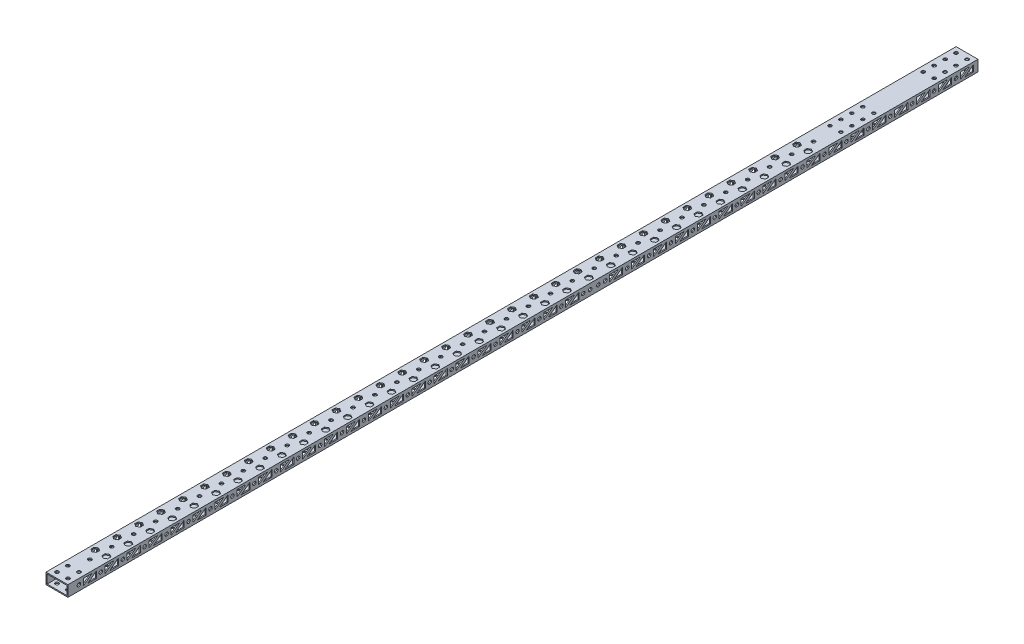
from build123d import *

# Parameters (mm, degrees)
SKETCH_1_W          = 20
SKETCH_1_H          = 10
SKETCH_1_W_2        = 18
SKETCH_1_H_2        = 8
EXTRUDE_1_DEPTH     = 830
SKETCH_2_R          = 1.575
SKETCH_2_R_2        = 1.5
CUT_EXTRUDE_1_DEPTH = 831.301150186
SKETCH_4_R          = 1.575
SKETCH_4_R_2        = 1.6
CUT_EXTRUDE_2_DEPTH = 831.301150186


with BuildPart() as part:
    # 草图1 → 拉伸-薄壁1 (new body)
    with BuildSketch(Plane.XY):
        with Locations((10, -5)):
            Rectangle(SKETCH_1_W, SKETCH_1_H)
        with Locations((10, -5)):
            Rectangle(SKETCH_1_W_2, SKETCH_1_H_2, mode=Mode.SUBTRACT)
    extrude(amount=EXTRUDE_1_DEPTH)

    # 草图2 → 切除-拉伸1 (cut, through all)
    with BuildSketch(Plane.XZ.offset(10)):
        with Locations((5, 5)):
            Circle(SKETCH_2_R)
        with Locations((15, 5)):
            Circle(SKETCH_2_R)
        with Locations((15, 15)):
            Circle(SKETCH_2_R)
        with Locations((5, 15)):
            Circle(SKETCH_2_R)
        with Locations((10, 140)):
            Circle(SKETCH_2_R)
        with Locations((10, 160)):
            Circle(SKETCH_2_R)
        with Locations((10, 180)):
            Circle(SKETCH_2_R)
        with Locations((10, 200)):
            Circle(SKETCH_2_R)
        with Locations((10, 220)):
            Circle(SKETCH_2_R)
        with Locations((10, 240)):
            Circle(SKETCH_2_R)
        with Locations((10, 260)):
            Circle(SKETCH_2_R)
        with Locations((10, 280)):
            Circle(SKETCH_2_R)
        with Locations((10, 300)):
            Circle(SKETCH_2_R)
        with Locations((10, 320)):
            Circle(SKETCH_2_R)
        with Locations((10, 340)):
            Circle(SKETCH_2_R)
        with Locations((10, 360)):
            Circle(SKETCH_2_R)
        with Locations((10, 380)):
            Circle(SKETCH_2_R)
        with Locations((10, 400)):
            Circle(SKETCH_2_R)
        with Locations((10, 420)):
            Circle(SKETCH_2_R)
        with Locations((10, 440)):
            Circle(SKETCH_2_R)
        with Locations((10, 460)):
            Circle(SKETCH_2_R)
        with Locations((10, 480)):
            Circle(SKETCH_2_R)
        with Locations((10, 500)):
            Circle(SKETCH_2_R)
        with Locations((10, 520)):
            Circle(SKETCH_2_R)
        with Locations((10, 540)):
            Circle(SKETCH_2_R)
        with Locations((10, 560)):
            Circle(SKETCH_2_R)
        with Locations((10, 580)):
            Circle(SKETCH_2_R)
        with Locations((10, 600)):
            Circle(SKETCH_2_R)
        with Locations((10, 620)):
            Circle(SKETCH_2_R)
        with Locations((10, 640)):
            Circle(SKETCH_2_R)
        with Locations((10, 660)):
            Circle(SKETCH_2_R)
        with Locations((10, 680)):
            Circle(SKETCH_2_R)
        with Locations((10, 700)):
            Circle(SKETCH_2_R)
        with Locations((10, 720)):
            Circle(SKETCH_2_R)
        with Locations((10, 740)):
            Circle(SKETCH_2_R)
        with Locations((5, 815)):
            Circle(SKETCH_2_R)
        with Locations((15, 815)):
            Circle(SKETCH_2_R)
        with Locations((15, 825)):
            Circle(SKETCH_2_R)
        with Locations((5, 825)):
            Circle(SKETCH_2_R)
        with Locations((10, 760)):
            Circle(SKETCH_2_R)
        with Locations((10, 780)):
            Circle(SKETCH_2_R)
        with Locations((10, 800)):
            Circle(SKETCH_2_R)
        with Locations((5, 120)):
            Circle(SKETCH_2_R_2)
        with Locations((15, 120)):
            Circle(SKETCH_2_R_2)
        with Locations((15, 110)):
            Circle(SKETCH_2_R_2)
        with Locations((5, 110)):
            Circle(SKETCH_2_R_2)
        with Locations((5, 100)):
            Circle(SKETCH_2_R_2)
        with Locations((15, 100)):
            Circle(SKETCH_2_R_2)
        with Locations((15, 90)):
            Circle(SKETCH_2_R_2)
        with Locations((5, 90)):
            Circle(SKETCH_2_R_2)
        with Locations((5, 25)):
            Circle(SKETCH_2_R)
        with Locations((15, 25)):
            Circle(SKETCH_2_R)
        with Locations((15, 35)):
            Circle(SKETCH_2_R)
        with Locations((5, 35)):
            Circle(SKETCH_2_R)
        Polygon((15.098076211, 787), (17.696152423, 788.5), (17.696152423, 791.5), (15.098076211, 793), (12.5, 791.5), (12.5, 788.5), align=None)
        Polygon((7.5, 788.5), (4.901923789, 787), (2.303847577, 788.5), (2.303847577, 791.5), (4.901923789, 793), (7.5, 791.5), align=None)
        Polygon((2.303847577, 771.5), (4.901923789, 773), (7.5, 771.5), (7.5, 768.5), (4.901923789, 767), (2.303847577, 768.5), align=None)
        Polygon((15.098076211, 773), (12.5, 771.5), (12.5, 768.5), (15.098076211, 767), (17.696152423, 768.5), (17.696152423, 771.5), align=None)
        Polygon((2.303847577, 751.5), (4.901923789, 753), (7.5, 751.5), (7.5, 748.5), (4.901923789, 747), (2.303847577, 748.5), align=None)
        Polygon((15.098076211, 753), (12.5, 751.5), (12.5, 748.5), (15.098076211, 747), (17.696152423, 748.5), (17.696152423, 751.5), align=None)
        Polygon((2.303847577, 731.5), (4.901923789, 733), (7.5, 731.5), (7.5, 728.5), (4.901923789, 727), (2.303847577, 728.5), align=None)
        Polygon((15.098076211, 733), (12.5, 731.5), (12.5, 728.5), (15.098076211, 727), (17.696152423, 728.5), (17.696152423, 731.5), align=None)
        Polygon((2.303847577, 711.5), (4.901923789, 713), (7.5, 711.5), (7.5, 708.5), (4.901923789, 707), (2.303847577, 708.5), align=None)
        Polygon((15.098076211, 713), (12.5, 711.5), (12.5, 708.5), (15.098076211, 707), (17.696152423, 708.5), (17.696152423, 711.5), align=None)
        Polygon((2.303847577, 691.5), (4.901923789, 693), (7.5, 691.5), (7.5, 688.5), (4.901923789, 687), (2.303847577, 688.5), align=None)
        Polygon((15.098076211, 693), (12.5, 691.5), (12.5, 688.5), (15.098076211, 687), (17.696152423, 688.5), (17.696152423, 691.5), align=None)
        Polygon((2.303847577, 671.5), (4.901923789, 673), (7.5, 671.5), (7.5, 668.5), (4.901923789, 667), (2.303847577, 668.5), align=None)
        Polygon((15.098076211, 673), (12.5, 671.5), (12.5, 668.5), (15.098076211, 667), (17.696152423, 668.5), (17.696152423, 671.5), align=None)
        Polygon((2.303847577, 651.5), (4.901923789, 653), (7.5, 651.5), (7.5, 648.5), (4.901923789, 647), (2.303847577, 648.5), align=None)
        Polygon((15.098076211, 653), (12.5, 651.5), (12.5, 648.5), (15.098076211, 647), (17.696152423, 648.5), (17.696152423, 651.5), align=None)
        Polygon((2.303847577, 631.5), (4.901923789, 633), (7.5, 631.5), (7.5, 628.5), (4.901923789, 627), (2.303847577, 628.5), align=None)
        Polygon((15.098076211, 633), (12.5, 631.5), (12.5, 628.5), (15.098076211, 627), (17.696152423, 628.5), (17.696152423, 631.5), align=None)
        Polygon((2.303847577, 611.5), (4.901923789, 613), (7.5, 611.5), (7.5, 608.5), (4.901923789, 607), (2.303847577, 608.5), align=None)
        Polygon((15.098076211, 613), (12.5, 611.5), (12.5, 608.5), (15.098076211, 607), (17.696152423, 608.5), (17.696152423, 611.5), align=None)
        Polygon((2.303847577, 591.5), (4.901923789, 593), (7.5, 591.5), (7.5, 588.5), (4.901923789, 587), (2.303847577, 588.5), align=None)
        Polygon((15.098076211, 593), (12.5, 591.5), (12.5, 588.5), (15.098076211, 587), (17.696152423, 588.5), (17.696152423, 591.5), align=None)
        Polygon((2.303847577, 571.5), (4.901923789, 573), (7.5, 571.5), (7.5, 568.5), (4.901923789, 567), (2.303847577, 568.5), align=None)
        Polygon((15.098076211, 573), (12.5, 571.5), (12.5, 568.5), (15.098076211, 567), (17.696152423, 568.5), (17.696152423, 571.5), align=None)
        Polygon((2.303847577, 551.5), (4.901923789, 553), (7.5, 551.5), (7.5, 548.5), (4.901923789, 547), (2.303847577, 548.5), align=None)
        Polygon((15.098076211, 553), (12.5, 551.5), (12.5, 548.5), (15.098076211, 547), (17.696152423, 548.5), (17.696152423, 551.5), align=None)
        Polygon((2.303847577, 531.5), (4.901923789, 533), (7.5, 531.5), (7.5, 528.5), (4.901923789, 527), (2.303847577, 528.5), align=None)
        Polygon((15.098076211, 533), (12.5, 531.5), (12.5, 528.5), (15.098076211, 527), (17.696152423, 528.5), (17.696152423, 531.5), align=None)
        Polygon((2.303847577, 511.5), (4.901923789, 513), (7.5, 511.5), (7.5, 508.5), (4.901923789, 507), (2.303847577, 508.5), align=None)
        Polygon((15.098076211, 513), (12.5, 511.5), (12.5, 508.5), (15.098076211, 507), (17.696152423, 508.5), (17.696152423, 511.5), align=None)
        Polygon((2.303847577, 491.5), (4.901923789, 493), (7.5, 491.5), (7.5, 488.5), (4.901923789, 487), (2.303847577, 488.5), align=None)
        Polygon((15.098076211, 493), (12.5, 491.5), (12.5, 488.5), (15.098076211, 487), (17.696152423, 488.5), (17.696152423, 491.5), align=None)
        Polygon((2.303847577, 471.5), (4.901923789, 473), (7.5, 471.5), (7.5, 468.5), (4.901923789, 467), (2.303847577, 468.5), align=None)
        Polygon((15.098076211, 473), (12.5, 471.5), (12.5, 468.5), (15.098076211, 467), (17.696152423, 468.5), (17.696152423, 471.5), align=None)
        Polygon((2.303847577, 451.5), (4.901923789, 453), (7.5, 451.5), (7.5, 448.5), (4.901923789, 447), (2.303847577, 448.5), align=None)
        Polygon((15.098076211, 453), (12.5, 451.5), (12.5, 448.5), (15.098076211, 447), (17.696152423, 448.5), (17.696152423, 451.5), align=None)
        Polygon((2.303847577, 431.5), (4.901923789, 433), (7.5, 431.5), (7.5, 428.5), (4.901923789, 427), (2.303847577, 428.5), align=None)
        Polygon((15.098076211, 433), (12.5, 431.5), (12.5, 428.5), (15.098076211, 427), (17.696152423, 428.5), (17.696152423, 431.5), align=None)
        Polygon((2.303847577, 411.5), (4.901923789, 413), (7.5, 411.5), (7.5, 408.5), (4.901923789, 407), (2.303847577, 408.5), align=None)
        Polygon((15.098076211, 413), (12.5, 411.5), (12.5, 408.5), (15.098076211, 407), (17.696152423, 408.5), (17.696152423, 411.5), align=None)
        Polygon((2.303847577, 391.5), (4.901923789, 393), (7.5, 391.5), (7.5, 388.5), (4.901923789, 387), (2.303847577, 388.5), align=None)
        Polygon((15.098076211, 393), (12.5, 391.5), (12.5, 388.5), (15.098076211, 387), (17.696152423, 388.5), (17.696152423, 391.5), align=None)
        Polygon((2.303847577, 371.5), (4.901923789, 373), (7.5, 371.5), (7.5, 368.5), (4.901923789, 367), (2.303847577, 368.5), align=None)
        Polygon((15.098076211, 373), (12.5, 371.5), (12.5, 368.5), (15.098076211, 367), (17.696152423, 368.5), (17.696152423, 371.5), align=None)
        Polygon((2.303847577, 351.5), (4.901923789, 353), (7.5, 351.5), (7.5, 348.5), (4.901923789, 347), (2.303847577, 348.5), align=None)
        Polygon((15.098076211, 353), (12.5, 351.5), (12.5, 348.5), (15.098076211, 347), (17.696152423, 348.5), (17.696152423, 351.5), align=None)
        Polygon((2.303847577, 331.5), (4.901923789, 333), (7.5, 331.5), (7.5, 328.5), (4.901923789, 327), (2.303847577, 328.5), align=None)
        Polygon((15.098076211, 333), (12.5, 331.5), (12.5, 328.5), (15.098076211, 327), (17.696152423, 328.5), (17.696152423, 331.5), align=None)
        Polygon((2.303847577, 311.5), (4.901923789, 313), (7.5, 311.5), (7.5, 308.5), (4.901923789, 307), (2.303847577, 308.5), align=None)
        Polygon((15.098076211, 313), (12.5, 311.5), (12.5, 308.5), (15.098076211, 307), (17.696152423, 308.5), (17.696152423, 311.5), align=None)
        Polygon((2.303847577, 291.5), (4.901923789, 293), (7.5, 291.5), (7.5, 288.5), (4.901923789, 287), (2.303847577, 288.5), align=None)
        Polygon((15.098076211, 293), (12.5, 291.5), (12.5, 288.5), (15.098076211, 287), (17.696152423, 288.5), (17.696152423, 291.5), align=None)
        Polygon((2.303847577, 271.5), (4.901923789, 273), (7.5, 271.5), (7.5, 268.5), (4.901923789, 267), (2.303847577, 268.5), align=None)
        Polygon((15.098076211, 273), (12.5, 271.5), (12.5, 268.5), (15.098076211, 267), (17.696152423, 268.5), (17.696152423, 271.5), align=None)
        Polygon((2.303847577, 251.5), (4.901923789, 253), (7.5, 251.5), (7.5, 248.5), (4.901923789, 247), (2.303847577, 248.5), align=None)
        Polygon((15.098076211, 253), (12.5, 251.5), (12.5, 248.5), (15.098076211, 247), (17.696152423, 248.5), (17.696152423, 251.5), align=None)
        Polygon((2.303847577, 231.5), (4.901923789, 233), (7.5, 231.5), (7.5, 228.5), (4.901923789, 227), (2.303847577, 228.5), align=None)
        Polygon((15.098076211, 233), (12.5, 231.5), (12.5, 228.5), (15.098076211, 227), (17.696152423, 228.5), (17.696152423, 231.5), align=None)
        Polygon((2.303847577, 211.5), (4.901923789, 213), (7.5, 211.5), (7.5, 208.5), (4.901923789, 207), (2.303847577, 208.5), align=None)
        Polygon((15.098076211, 213), (12.5, 211.5), (12.5, 208.5), (15.098076211, 207), (17.696152423, 208.5), (17.696152423, 211.5), align=None)
        Polygon((2.303847577, 191.5), (4.901923789, 193), (7.5, 191.5), (7.5, 188.5), (4.901923789, 187), (2.303847577, 188.5), align=None)
        Polygon((15.098076211, 193), (12.5, 191.5), (12.5, 188.5), (15.098076211, 187), (17.696152423, 188.5), (17.696152423, 191.5), align=None)
        Polygon((2.303847577, 171.5), (4.901923789, 173), (7.5, 171.5), (7.5, 168.5), (4.901923789, 167), (2.303847577, 168.5), align=None)
        Polygon((15.098076211, 173), (12.5, 171.5), (12.5, 168.5), (15.098076211, 167), (17.696152423, 168.5), (17.696152423, 171.5), align=None)
        Polygon((2.303847577, 151.5), (4.901923789, 153), (7.5, 151.5), (7.5, 148.5), (4.901923789, 147), (2.303847577, 148.5), align=None)
        Polygon((15.098076211, 153), (12.5, 151.5), (12.5, 148.5), (15.098076211, 147), (17.696152423, 148.5), (17.696152423, 151.5), align=None)
    extrude(amount=-CUT_EXTRUDE_1_DEPTH, mode=Mode.SUBTRACT)

    # 草图4 → 切除-拉伸2 (cut, through all)
    with BuildSketch(Plane(origin=(20, 0, 0), x_dir=(0, 0, -1), z_dir=(1, 0, 0))):
        with Locations((-20, -5)):
            Circle(SKETCH_4_R)
        with Locations((-40, -5)):
            Circle(SKETCH_4_R)
        with Locations((-60, -5)):
            Circle(SKETCH_4_R)
        with Locations((-80, -5)):
            Circle(SKETCH_4_R)
        with Locations((-100, -5)):
            Circle(SKETCH_4_R)
        with Locations((-120, -5)):
            Circle(SKETCH_4_R)
        with Locations((-140, -5)):
            Circle(SKETCH_4_R)
        with Locations((-160, -5)):
            Circle(SKETCH_4_R)
        with Locations((-180, -5)):
            Circle(SKETCH_4_R)
        with Locations((-200, -5)):
            Circle(SKETCH_4_R)
        with Locations((-220, -5)):
            Circle(SKETCH_4_R)
        with Locations((-240, -5)):
            Circle(SKETCH_4_R)
        with Locations((-260, -5)):
            Circle(SKETCH_4_R)
        with Locations((-280, -5)):
            Circle(SKETCH_4_R)
        with Locations((-300, -5)):
            Circle(SKETCH_4_R)
        with Locations((-320, -5)):
            Circle(SKETCH_4_R)
        with Locations((-340, -5)):
            Circle(SKETCH_4_R)
        with Locations((-360, -5)):
            Circle(SKETCH_4_R)
        with Locations((-380, -5)):
            Circle(SKETCH_4_R)
        with Locations((-400, -5)):
            Circle(SKETCH_4_R)
        with Locations((-420, -5)):
            Circle(SKETCH_4_R)
        with Locations((-440, -5)):
            Circle(SKETCH_4_R)
        with Locations((-460, -5)):
            Circle(SKETCH_4_R)
        with Locations((-480, -5)):
            Circle(SKETCH_4_R)
        with Locations((-500, -5)):
            Circle(SKETCH_4_R)
        with Locations((-520, -5)):
            Circle(SKETCH_4_R)
        with Locations((-540, -5)):
            Circle(SKETCH_4_R)
        with Locations((-560, -5)):
            Circle(SKETCH_4_R)
        with Locations((-580, -5)):
            Circle(SKETCH_4_R)
        with Locations((-600, -5)):
            Circle(SKETCH_4_R)
        with Locations((-620, -5)):
            Circle(SKETCH_4_R)
        with Locations((-640, -5)):
            Circle(SKETCH_4_R)
        with Locations((-660, -5)):
            Circle(SKETCH_4_R)
        with Locations((-680, -5)):
            Circle(SKETCH_4_R)
        with Locations((-700, -5)):
            Circle(SKETCH_4_R)
        with Locations((-720, -5)):
            Circle(SKETCH_4_R)
        with Locations((-740, -5)):
            Circle(SKETCH_4_R)
        with Locations((-760, -5)):
            Circle(SKETCH_4_R)
        with Locations((-780, -5)):
            Circle(SKETCH_4_R)
        with Locations((-800, -5)):
            Circle(SKETCH_4_R)
        with Locations((-820, -5)):
            Circle(SKETCH_4_R)
        with Locations((-353.75, -5)):
            Circle(SKETCH_4_R_2)
        with Locations((-346.25, -5)):
            Circle(SKETCH_4_R_2)
        Polygon((-4, -2), (-4, -8), (-12, -8), align=None)
        Polygon((-8, -2), (-16, -8), (-16, -2), align=None)
        Polygon((-24, -2), (-24, -8), (-32, -8), align=None)
        Polygon((-36, -2), (-28, -2), (-36, -8), align=None)
        Polygon((-44, -2), (-44, -8), (-52, -8), align=None)
        Polygon((-56, -2), (-48, -2), (-56, -8), align=None)
        Polygon((-64, -2), (-64, -8), (-72, -8), align=None)
        Polygon((-76, -2), (-68, -2), (-76, -8), align=None)
        Polygon((-84, -2), (-84, -8), (-92, -8), align=None)
        Polygon((-96, -2), (-88, -2), (-96, -8), align=None)
        Polygon((-104, -2), (-104, -8), (-112, -8), align=None)
        Polygon((-116, -2), (-108, -2), (-116, -8), align=None)
        Polygon((-124, -2), (-124, -8), (-132, -8), align=None)
        Polygon((-136, -2), (-128, -2), (-136, -8), align=None)
        Polygon((-144, -2), (-144, -8), (-152, -8), align=None)
        Polygon((-156, -2), (-148, -2), (-156, -8), align=None)
        Polygon((-164, -2), (-164, -8), (-172, -8), align=None)
        Polygon((-176, -2), (-168, -2), (-176, -8), align=None)
        Polygon((-184, -2), (-184, -8), (-192, -8), align=None)
        Polygon((-196, -2), (-188, -2), (-196, -8), align=None)
        Polygon((-204, -2), (-204, -8), (-212, -8), align=None)
        Polygon((-216, -2), (-208, -2), (-216, -8), align=None)
        Polygon((-224, -2), (-224, -8), (-232, -8), align=None)
        Polygon((-236, -2), (-228, -2), (-236, -8), align=None)
        Polygon((-244, -2), (-244, -8), (-252, -8), align=None)
        Polygon((-256, -2), (-248, -2), (-256, -8), align=None)
        Polygon((-264, -2), (-264, -8), (-272, -8), align=None)
        Polygon((-276, -2), (-268, -2), (-276, -8), align=None)
        Polygon((-284, -2), (-284, -8), (-292, -8), align=None)
        Polygon((-296, -2), (-288, -2), (-296, -8), align=None)
        Polygon((-304, -2), (-304, -8), (-312, -8), align=None)
        Polygon((-316, -2), (-308, -2), (-316, -8), align=None)
        Polygon((-324, -2), (-324, -8), (-332, -8), align=None)
        Polygon((-336, -2), (-328, -2), (-336, -8), align=None)
        Polygon((-364, -2), (-364, -8), (-372, -8), align=None)
        Polygon((-376, -2), (-368, -2), (-376, -8), align=None)
        Polygon((-384, -2), (-384, -8), (-392, -8), align=None)
        Polygon((-396, -2), (-388, -2), (-396, -8), align=None)
        Polygon((-404, -2), (-404, -8), (-412, -8), align=None)
        Polygon((-416, -2), (-408, -2), (-416, -8), align=None)
        Polygon((-424, -2), (-424, -8), (-432, -8), align=None)
        Polygon((-436, -2), (-428, -2), (-436, -8), align=None)
        Polygon((-444, -2), (-444, -8), (-452, -8), align=None)
        Polygon((-456, -2), (-448, -2), (-456, -8), align=None)
        Polygon((-464, -2), (-464, -8), (-472, -8), align=None)
        Polygon((-476, -2), (-468, -2), (-476, -8), align=None)
        Polygon((-484, -2), (-484, -8), (-492, -8), align=None)
        Polygon((-496, -2), (-488, -2), (-496, -8), align=None)
        Polygon((-504, -2), (-504, -8), (-512, -8), align=None)
        Polygon((-516, -2), (-508, -2), (-516, -8), align=None)
        Polygon((-524, -2), (-524, -8), (-532, -8), align=None)
        Polygon((-536, -2), (-528, -2), (-536, -8), align=None)
        Polygon((-544, -2), (-544, -8), (-552, -8), align=None)
        Polygon((-556, -2), (-548, -2), (-556, -8), align=None)
        Polygon((-564, -2), (-564, -8), (-572, -8), align=None)
        Polygon((-576, -2), (-568, -2), (-576, -8), align=None)
        Polygon((-584, -2), (-584, -8), (-592, -8), align=None)
        Polygon((-596, -2), (-588, -2), (-596, -8), align=None)
        Polygon((-604, -2), (-604, -8), (-612, -8), align=None)
        Polygon((-616, -2), (-608, -2), (-616, -8), align=None)
        Polygon((-624, -2), (-624, -8), (-632, -8), align=None)
        Polygon((-636, -2), (-628, -2), (-636, -8), align=None)
        Polygon((-644, -2), (-644, -8), (-652, -8), align=None)
        Polygon((-656, -2), (-648, -2), (-656, -8), align=None)
        Polygon((-664, -2), (-664, -8), (-672, -8), align=None)
        Polygon((-676, -2), (-668, -2), (-676, -8), align=None)
        Polygon((-684, -2), (-684, -8), (-692, -8), align=None)
        Polygon((-696, -2), (-688, -2), (-696, -8), align=None)
        Polygon((-704, -2), (-704, -8), (-712, -8), align=None)
        Polygon((-716, -2), (-708, -2), (-716, -8), align=None)
        Polygon((-724, -2), (-724, -8), (-732, -8), align=None)
        Polygon((-736, -2), (-728, -2), (-736, -8), align=None)
        Polygon((-744, -2), (-744, -8), (-752, -8), align=None)
        Polygon((-756, -2), (-748, -2), (-756, -8), align=None)
        Polygon((-764, -2), (-764, -8), (-772, -8), align=None)
        Polygon((-776, -2), (-768, -2), (-776, -8), align=None)
        Polygon((-784, -2), (-784, -8), (-792, -8), align=None)
        Polygon((-796, -2), (-788, -2), (-796, -8), align=None)
        Polygon((-804, -2), (-804, -8), (-812, -8), align=None)
        Polygon((-816, -2), (-808, -2), (-816, -8), align=None)
    extrude(amount=-CUT_EXTRUDE_2_DEPTH, mode=Mode.SUBTRACT)


solid = part.part
